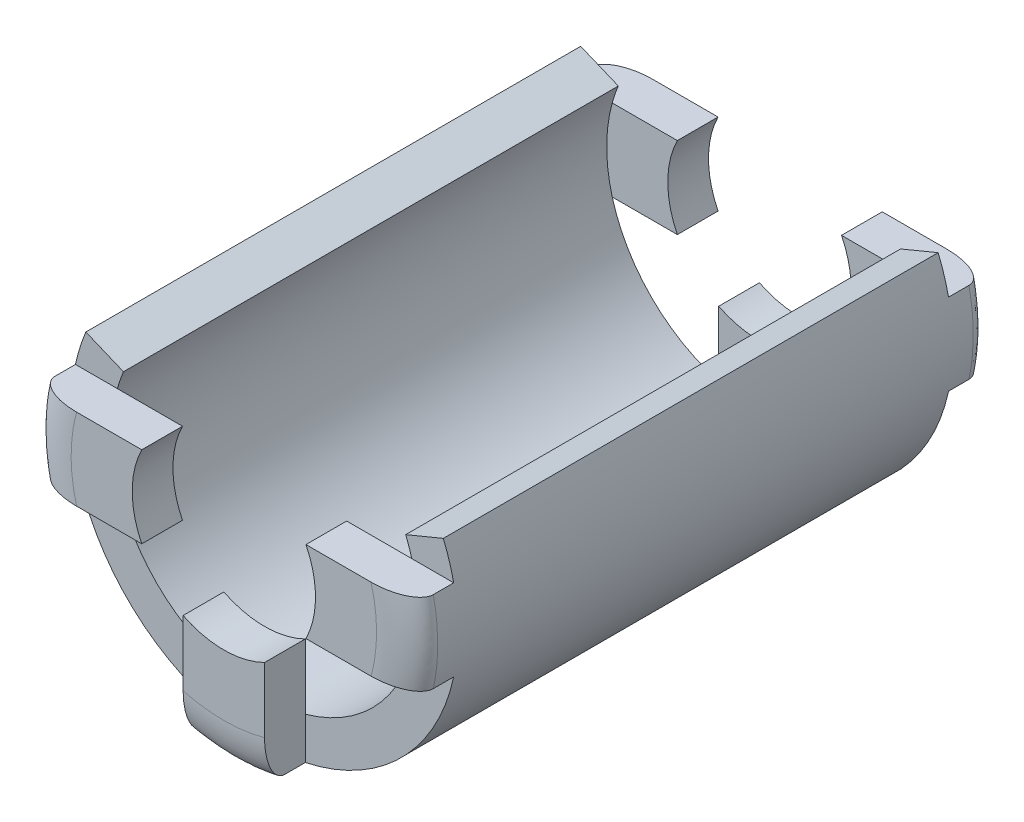
from build123d import *
from build123d.topology import SkipClean

# Parameters (mm, degrees)
BOSS_EXTRUDE1_DEPTH            = 24.3
CUT_EXTRUDE3_REACH             = 29.767
SKETCH4_R                      = 7.6
CUT_EXTRUDE3_DIRECTION_2_REACH = 29.767
BOSS_EXTRUDE2_START            = 2
BOSS_EXTRUDE2_DEPTH            = 2
FILLET1_SIZE                   = 1
FILLET1_SIZE_2                 = 2


with BuildPart() as part:
    # Sketch1 → Boss-Extrude1 (new body)
    with BuildSketch(Plane.XY):
        with BuildLine():
            Line((-6.929096494, 2.870125743), (-8.776855559, 3.635492607))
            ThreePointArc((-8.776855559, 3.635492607), (0, -9.5), (8.776855559, 3.635492607))
            Line((8.776855559, 3.635492607), (6.929096494, 2.870125743))
            ThreePointArc((6.929096494, 2.870125743), (0, -7.5), (-6.929096494, 2.870125743))
        make_face()
    extrude(amount=-BOSS_EXTRUDE1_DEPTH)

    # Sketch4 → Cut-Extrude3 (cut, up to next)
    with BuildSketch(Plane(origin=(0, 0, 0), x_dir=(0, 0, -1), z_dir=(1, 0, 0)), mode=Mode.PRIVATE) as cut_extrude3_sk1:
        with Locations((7.6, -15)):
            Circle(SKETCH4_R)
    cut_extrude3_tool1 = extrude(cut_extrude3_sk1.sketch, amount=-CUT_EXTRUDE3_REACH, mode=Mode.PRIVATE) & part.part
    add(cut_extrude3_tool1.solids().sort_by_distance((0, -15, -7.6))[0], mode=Mode.SUBTRACT)

    # Sketch4 → Cut-Extrude3 direction 2 (cut, up to next)
    with BuildSketch(Plane(origin=(0, 0, 0), x_dir=(0, 0, -1), z_dir=(1, 0, 0)), mode=Mode.PRIVATE) as cut_extrude3_direction_2_sk1:
        with Locations((7.6, -15)):
            Circle(SKETCH4_R)
    cut_extrude3_direction_2_tool1 = extrude(cut_extrude3_direction_2_sk1.sketch, amount=CUT_EXTRUDE3_DIRECTION_2_REACH, mode=Mode.PRIVATE) & part.part
    add(cut_extrude3_direction_2_tool1.solids().sort_by_distance((0, -15, -7.6))[0], mode=Mode.SUBTRACT)

    # Sketch6 → Boss-Extrude2 (add)
    with SkipClean():  # the faces are left unmerged after this step: merging them gives an invalid solid
        with BuildSketch(Plane.XY.offset(BOSS_EXTRUDE2_START)):
            with BuildLine():
                Line((-9.287087811, 2), (-4.031128874, 2))
                ThreePointArc((-4.031128874, 2), (-4.5, 0), (-4.031128874, -2))
                Line((-4.031128874, -2), (-9.287087811, -2))
                ThreePointArc((-9.287087811, -2), (-9.5, 0), (-9.287087811, 2))
            make_face()
            with BuildLine():
                Line((9.287087811, -2), (4.031128874, -2))
                ThreePointArc((4.031128874, -2), (4.5, 0), (4.031128874, 2))
                Line((4.031128874, 2), (9.287087811, 2))
                ThreePointArc((9.287087811, 2), (9.5, 0), (9.287087811, -2))
            make_face()
            with BuildLine():
                Line((-2, -9.287087811), (-2, -4.031128874))
                ThreePointArc((-2, -4.031128874), (0, -4.5), (2, -4.031128874))
                Line((2, -4.031128874), (2, -9.287087811))
                ThreePointArc((2, -9.287087811), (0, -9.5), (-2, -9.287087811))
            make_face()
        boss_extrude2 = extrude(amount=-BOSS_EXTRUDE2_DEPTH)

    # Mirror1: Boss-Extrude2 across plane
    with SkipClean():  # the faces are left unmerged after this step: merging them gives an invalid solid
        add(boss_extrude2.mirror(Plane.XY.offset(-12.15)))

    # Fillet1
    # an asymmetric fillet: 2, 1 mm, written as the material it takes off along each edge
    with BuildSketch(Plane(origin=(0, 0, -26.3), x_dir=(0.7395165083482822, 0.6731384210401047, 0), z_dir=(-0.6731384210401047, 0.7395165083482822, 0))) as fillet1_piece_1:
        with BuildLine():
            Bezier((9.5, -FILLET1_SIZE), (9.5, 0), (9.5 - FILLET1_SIZE_2, 0), weights=[1, 0.707106781, 1])
            Line((9.5 - FILLET1_SIZE_2, 0), (9.5, 0))
            Line((9.5, 0), (9.5, -FILLET1_SIZE))
        make_face()
    revolve(axis=Axis((0, 0, -26.3), (0, 0, -1)), revolution_arc=84.619508452, mode=Mode.SUBTRACT)
    with BuildSketch(Plane(origin=(0, 0, -26.3), x_dir=(0.6731384210401101, -0.7395165083482772, 0), z_dir=(0.7395165083482772, 0.6731384210401101, 0))) as fillet1_piece_2:
        with BuildLine():
            Bezier((9.5, -FILLET1_SIZE_2), (9.5, 0), (9.5 - FILLET1_SIZE, 0), weights=[1, 0.707106781, 1])
            Line((9.5 - FILLET1_SIZE, 0), (9.5, 0))
            Line((9.5, 0), (9.5, -FILLET1_SIZE_2))
        make_face()
    revolve(axis=Axis((0, 0, -26.3), (0, 0, -1)), revolution_arc=84.619508452, mode=Mode.SUBTRACT)
    with BuildSketch(Plane(origin=(0, 0, -26.3), x_dir=(-0.7395165083482795, -0.6731384210401073, 0), z_dir=(0.6731384210401073, -0.7395165083482795, 0))) as fillet1_piece_3:
        with BuildLine():
            Bezier((9.5, -FILLET1_SIZE), (9.5, 0), (9.5 - FILLET1_SIZE_2, 0), weights=[1, 0.707106781, 1])
            Line((9.5 - FILLET1_SIZE_2, 0), (9.5, 0))
            Line((9.5, 0), (9.5, -FILLET1_SIZE))
        make_face()
    revolve(axis=Axis((0, 0, -26.3), (0, 0, -1)), revolution_arc=84.619508452, mode=Mode.SUBTRACT)
    with BuildSketch(Plane(origin=(0, 0, 2), x_dir=(0.7395165083482822, 0.6731384210401047, 0), z_dir=(-0.6731384210401047, 0.7395165083482822, 0))) as fillet1_piece_4:
        with BuildLine():
            Bezier((9.5, FILLET1_SIZE), (9.5, 0), (9.5 - FILLET1_SIZE_2, 0), weights=[1, 0.707106781, 1])
            Line((9.5 - FILLET1_SIZE_2, 0), (9.5, 0))
            Line((9.5, 0), (9.5, FILLET1_SIZE))
        make_face()
    revolve(axis=Axis((0, 0, 2), (0, 0, -1)), revolution_arc=84.619508452, mode=Mode.SUBTRACT)
    with BuildSketch(Plane(origin=(0, 0, 2), x_dir=(0.6731384210401101, -0.7395165083482772, 0), z_dir=(0.7395165083482772, 0.6731384210401101, 0))) as fillet1_piece_5:
        with BuildLine():
            Bezier((9.5, FILLET1_SIZE), (9.5, 0), (9.5 - FILLET1_SIZE_2, 0), weights=[1, 0.707106781, 1])
            Line((9.5 - FILLET1_SIZE_2, 0), (9.5, 0))
            Line((9.5, 0), (9.5, FILLET1_SIZE))
        make_face()
    revolve(axis=Axis((0, 0, 2), (0, 0, -1)), revolution_arc=84.619508452, mode=Mode.SUBTRACT)
    with BuildSketch(Plane(origin=(0, 0, 2), x_dir=(-0.7395165083482795, -0.6731384210401073, 0), z_dir=(0.6731384210401073, -0.7395165083482795, 0))) as fillet1_piece_6:
        with BuildLine():
            Bezier((9.5, FILLET1_SIZE), (9.5, 0), (9.5 - FILLET1_SIZE_2, 0), weights=[1, 0.707106781, 1])
            Line((9.5 - FILLET1_SIZE_2, 0), (9.5, 0))
            Line((9.5, 0), (9.5, FILLET1_SIZE))
        make_face()
    revolve(axis=Axis((0, 0, 2), (0, 0, -1)), revolution_arc=84.619508452, mode=Mode.SUBTRACT)


solid = part.part
